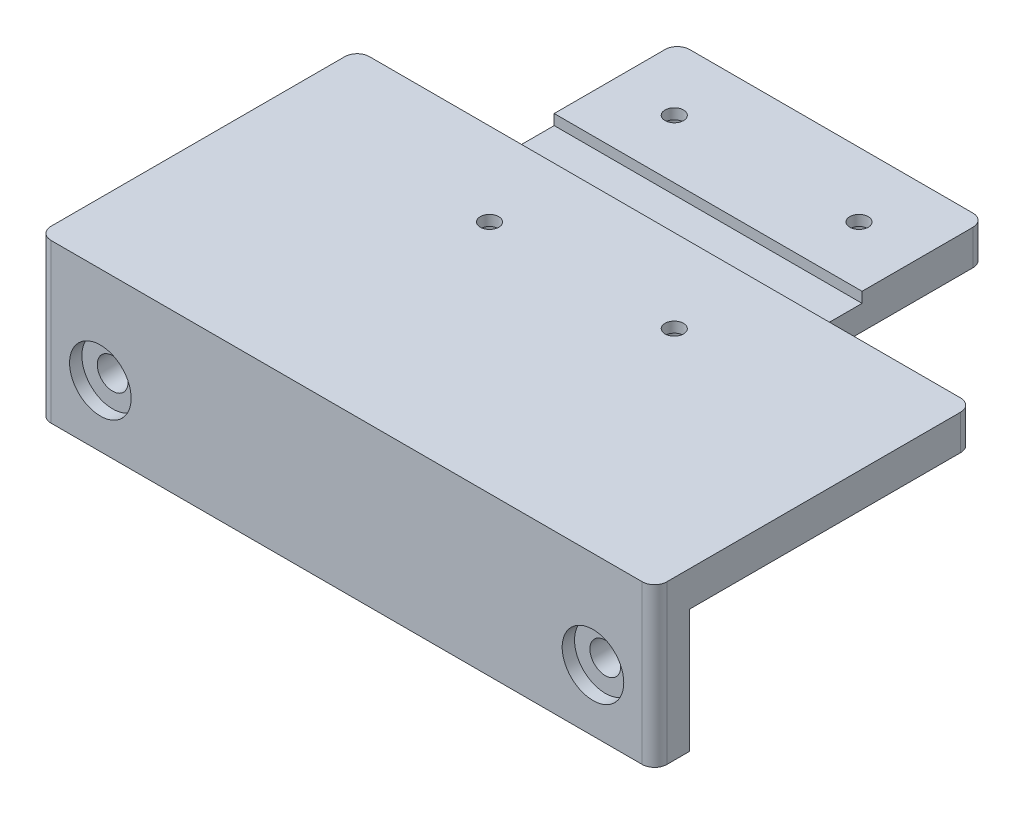
from build123d import *

# Parameters (mm, degrees)
BOSS_EXTRUDE1_DEPTH     = 50
BOSS_EXTRUDE2_DEPTH     = 25
CHAMFER1_SIZE           = 1
CUT_EXTRUDE1_DEPTH      = 76.208044782
CUT_EXTRUDE1_DEPTH_BACK = 76.208044782
SKETCH2_R               = 1.5
CUT_EXTRUDE2_DEPTH      = 76.208044782
CUT_EXTRUDE2_DEPTH_BACK = 4
SKETCH2_3_R             = 2.5
SKETCH2_3_R_2           = 1.5
CUT_EXTRUDE3_DEPTH      = 92.348180058
CUT_EXTRUDE3_DEPTH_BACK = 92.348180058
SKETCH3_R               = 2.5
CUT_EXTRUDE4_START      = -4.7
SKETCH3_3_R             = 5
SKETCH3_3_R_2           = 2.5
CUT_EXTRUDE4_DEPTH      = 2
FILLET1_R               = 2


with BuildPart() as part:
    # Sketch1 → Boss-Extrude1 (new, symmetric)
    with BuildSketch(Plane(origin=(0, 0, 0), x_dir=(0, 0, -1), z_dir=(1, 0, 0))):
        Polygon((25.5, 25.7), (25.5, 20), (14.5, 20), (14.5, 19), (5.5, 19), (5.5, 20), (-5.5, 20), (-5.5, 19), (-14.5, 19), (-14.5, 20), (-20.5, 20), (-20.5, 14.5), (-19.5, 14.5), (-19.5, 5.5), (-20.5, 5.5), (-20.5, 0), (-26.2, 0), (-26.2, 25.7), align=None)
    extrude(amount=BOSS_EXTRUDE1_DEPTH, both=True)

    # Sketch1<3> → Boss-Extrude2 (add, symmetric)
    with BuildSketch(Plane(origin=(0, 0, 0), x_dir=(0, 0, -1), z_dir=(1, 0, 0))):
        Polygon((32.5, 24), (25.5, 24), (25.5, 20), (52.5, 20), (52.5, 25.7), (32.5, 25.7), align=None)
    extrude(amount=BOSS_EXTRUDE2_DEPTH, both=True)

    # Chamfer1
    chamfer1_edges = [part.edges().sort_by_distance(p)[0] for p in [
        (0, 5.5, 19.5),
        (0, 14.5, 19.5),
        (0, 19, 14.5),
        (0, 19, 5.5),
        (0, 19, -5.5),
        (0, 19, -14.5),
        (-50, 10, 19.5),
        (50, 10, 19.5),
        (50, 19, 10),
        (-50, 19, 10),
        (50, 19, -10),
        (-50, 19, -10),
    ]]
    chamfer(chamfer1_edges, length=CHAMFER1_SIZE - 0.0001)  # a hair under: the kernel refuses the full size

    # Sketch2 → Cut-Extrude1 (cut, two sides: drawn at the far end of the back side and taken through both)
    with BuildSketch(Plane.XZ.offset(-20).offset(-CUT_EXTRUDE1_DEPTH_BACK)):
        with Locations(Location((-15, -42, 0), (0, 0, 270))):
            Circle(SKETCH2_R)
        with Locations(Location((15, -42, 0), (0, 0, 270))):
            Circle(SKETCH2_R)
        with Locations(Location((-15, -12, 0), (0, 0, 270))):
            Circle(SKETCH2_R)
        with Locations(Location((15, -12, 0), (0, 0, 270))):
            Circle(SKETCH2_R)
    extrude(amount=CUT_EXTRUDE1_DEPTH + CUT_EXTRUDE1_DEPTH_BACK, mode=Mode.SUBTRACT)

    # Sketch2<3> → Cut-Extrude2 (cut, two sides: drawn at the far end of the back side and taken through both)
    # profile 1 of 4: a face of its own
    with BuildSketch(Plane.XZ.offset(-20).offset(-CUT_EXTRUDE2_DEPTH_BACK)):
        with Locations(Location((-15, -12, 0), (0, 0, 270))):
            Circle(SKETCH2_3_R)
        with Locations(Location((-15, -12, 0), (0, 0, 270))):
            Circle(SKETCH2_3_R_2, mode=Mode.SUBTRACT)
    # profile 2 of 4: a face of its own
    with BuildSketch(Plane.XZ.offset(-20).offset(-CUT_EXTRUDE2_DEPTH_BACK)):
        with Locations(Location((-15, -42, 0), (0, 0, 90))):
            Circle(SKETCH2_3_R)
        with Locations(Location((-15, -42, 0), (0, 0, 270))):
            Circle(SKETCH2_3_R_2, mode=Mode.SUBTRACT)
    # profile 3 of 4: a face of its own
    with BuildSketch(Plane.XZ.offset(-20).offset(-CUT_EXTRUDE2_DEPTH_BACK)):
        with Locations(Location((15, -42, 0), (0, 0, 90))):
            Circle(SKETCH2_3_R)
        with Locations(Location((15, -42, 0), (0, 0, 270))):
            Circle(SKETCH2_3_R_2, mode=Mode.SUBTRACT)
    # profile 4 of 4: a face of its own
    with BuildSketch(Plane.XZ.offset(-20).offset(-CUT_EXTRUDE2_DEPTH_BACK)):
        with Locations(Location((15, -12, 0), (0, 0, 90))):
            Circle(SKETCH2_3_R)
        with Locations(Location((15, -12, 0), (0, 0, 270))):
            Circle(SKETCH2_3_R_2, mode=Mode.SUBTRACT)
    extrude(amount=CUT_EXTRUDE2_DEPTH + CUT_EXTRUDE2_DEPTH_BACK, mode=Mode.SUBTRACT)

    # Sketch3 → Cut-Extrude3 (cut, two sides: drawn at the far end of the back side and taken through both)
    with BuildSketch(Plane(origin=(0, 0, 19.5), x_dir=(-1, 0, 0), z_dir=(0, 0, -1)).offset(-CUT_EXTRUDE3_DEPTH_BACK)):
        with Locations((-40, 10)):
            Circle(SKETCH3_R)
        with Locations((40, 10)):
            Circle(SKETCH3_R)
    extrude(amount=CUT_EXTRUDE3_DEPTH + CUT_EXTRUDE3_DEPTH_BACK, mode=Mode.SUBTRACT)

    # Sketch3<3> → Cut-Extrude4 (cut)
    # profile 1 of 2: a face of its own
    with BuildSketch(Plane(origin=(0, 0, 19.5), x_dir=(-1, 0, 0), z_dir=(0, 0, -1)).offset(CUT_EXTRUDE4_START)):
        with Locations(Location((-40, 10, 0), (0, 0, 180))):
            Circle(SKETCH3_3_R)
        with Locations((-40, 10)):
            Circle(SKETCH3_3_R_2, mode=Mode.SUBTRACT)
    # profile 2 of 2: a face of its own
    with BuildSketch(Plane(origin=(0, 0, 19.5), x_dir=(-1, 0, 0), z_dir=(0, 0, -1)).offset(CUT_EXTRUDE4_START)):
        with Locations(Location((40, 10, 0), (0, 0, 180))):
            Circle(SKETCH3_3_R)
        with Locations((40, 10)):
            Circle(SKETCH3_3_R_2, mode=Mode.SUBTRACT)
    extrude(amount=-CUT_EXTRUDE4_DEPTH, mode=Mode.SUBTRACT)

    # Fillet1
    fillet1_edges = [part.edges().sort_by_distance(p)[0] for p in [
        (50, 12.85, 26.2),
        (-50, 12.85, 26.2),
        (-50, 22.85, -25.5),
        (50, 22.85, -25.5),
        (25, 22.85, -52.5),
        (-25, 22.85, -52.5),
    ]]
    fillet(fillet1_edges, radius=FILLET1_R)


solid = part.part
